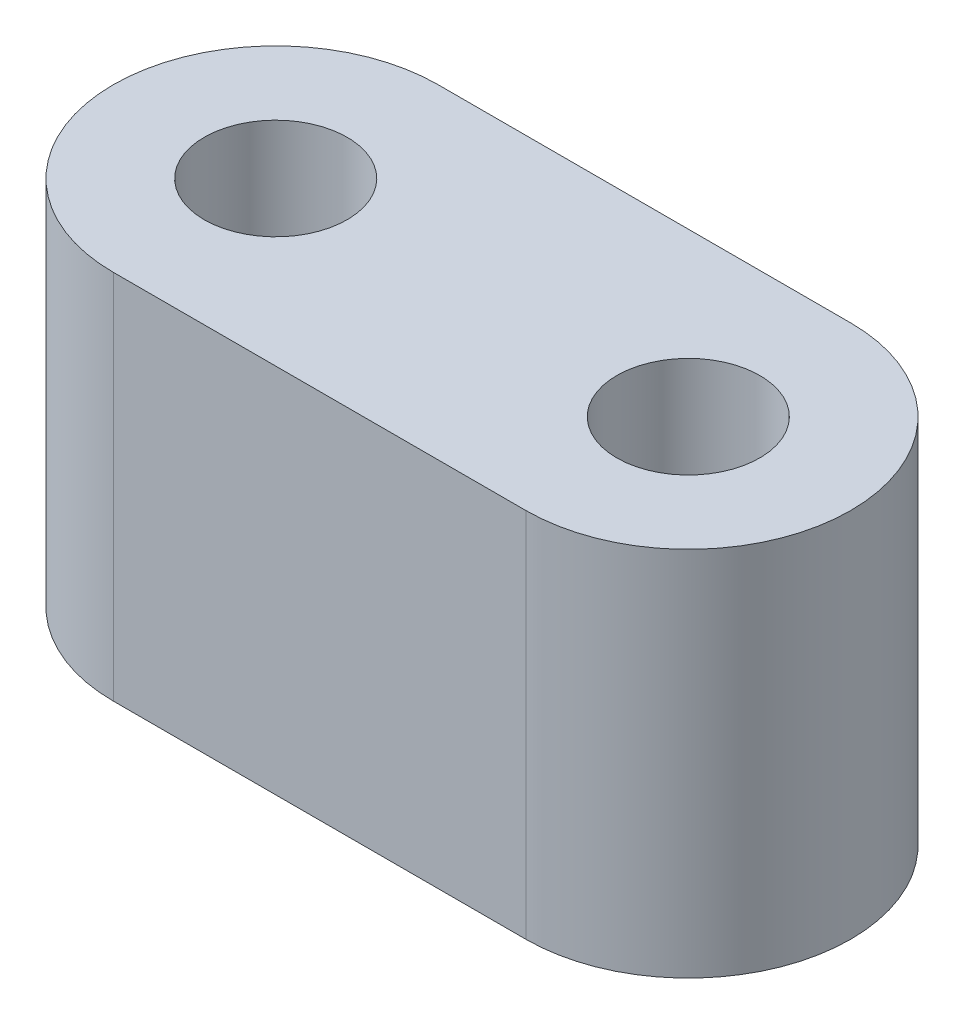
from build123d import *

# Parameters (mm, degrees)
SKETCH1_R           = 2.2
BOSS_EXTRUDE1_DEPTH = 11.43


with BuildPart() as part:
    # Sketch1 → Boss-Extrude1 (new body)
    with BuildSketch(Plane(origin=(0, 0, 0), x_dir=(1, 0, 0), z_dir=(0, 1, 0))):
        with BuildLine():
            Line((0, 5), (12.7, 5))
            ThreePointArc((12.7, 5), (17.7, 0), (12.7, -5))
            Line((12.7, -5), (0, -5))
            ThreePointArc((0, -5), (-5, 0), (0, 5))
        make_face()
        Circle(SKETCH1_R, mode=Mode.SUBTRACT)
        with Locations((12.7, 0)):
            Circle(SKETCH1_R, mode=Mode.SUBTRACT)
    extrude(amount=BOSS_EXTRUDE1_DEPTH)


solid = part.part
